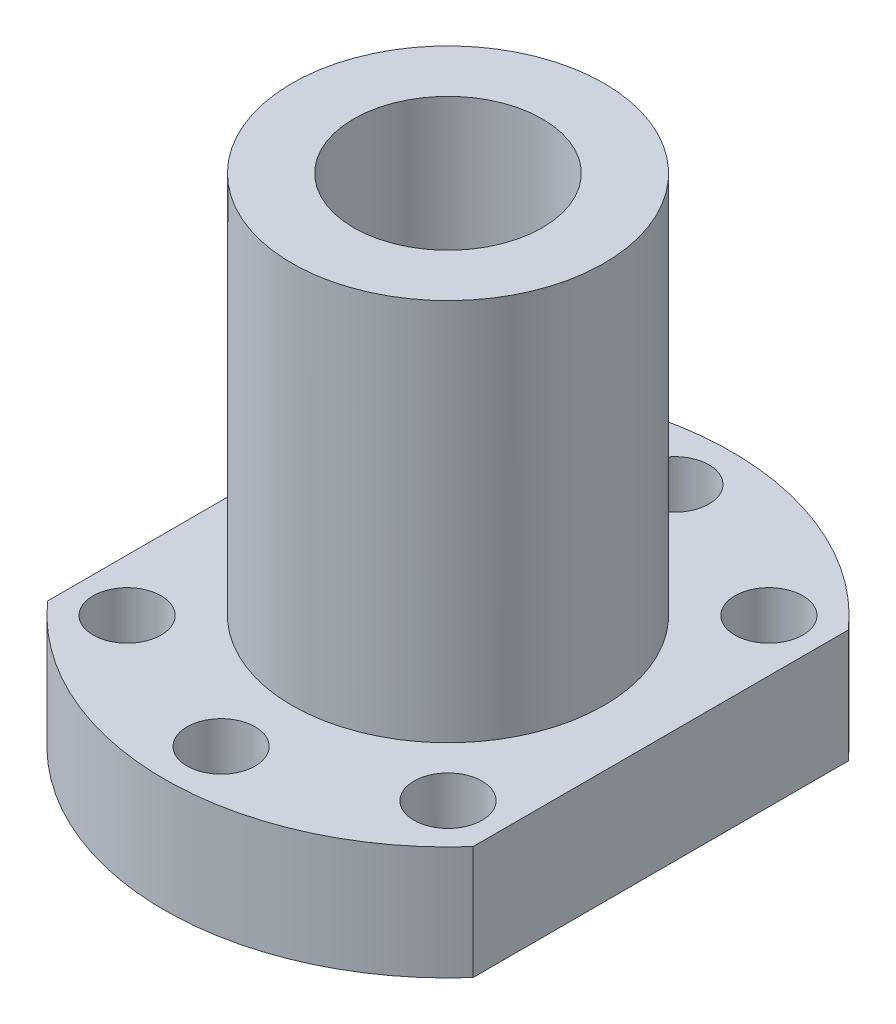
from build123d import *

# Parameters (mm, degrees)
SKETCH_1_R          = 20
EXTRUDE_1_DEPTH     = 8
SKETCH_3_R          = 11
EXTRUDE_2_DEPTH     = 35
CUT_EXTRUDE_1_DEPTH = 46
SKETCH_6_R          = 2.4
CUT_EXTRUDE_2_DEPTH = 44.011626335
SKETCH_7_R          = 6.65
CUT_EXTRUDE_3_DEPTH = 44.011626335


with BuildPart() as part:
    # 草图1 → 凸台-拉伸1 (new body)
    with BuildSketch(Plane(origin=(0, 0, 0), x_dir=(1, 0, 0), z_dir=(0, 1, 0))):
        Circle(SKETCH_1_R)
    extrude(amount=EXTRUDE_1_DEPTH)

    # 草图3 → 凸台-拉伸2 (add)
    with BuildSketch(Plane.XZ):
        Circle(SKETCH_3_R)
    extrude(amount=-EXTRUDE_2_DEPTH)

    # 草图4 → 切除-拉伸1 (cut, through all)
    with BuildSketch(Plane.XZ):
        with BuildLine():
            Line((-15, 13.228756555), (-15, -13.228756555))
            ThreePointArc((-15, -13.228756555), (-20, 0), (-15, 13.228756555))
        make_face()
        with BuildLine():
            Line((15, 13.228756555), (15, -13.228756555))
            ThreePointArc((15, -13.228756555), (20, 0), (15, 13.228756555))
        make_face()
    extrude(amount=-CUT_EXTRUDE_1_DEPTH, mode=Mode.SUBTRACT)

    # 草图6 → 切除-拉伸2 (cut, through all)
    with BuildSketch(Plane.XZ):
        with Locations((0, 16)):
            Circle(SKETCH_6_R)
        with Locations((11.313708499, 11.313708499)):
            Circle(SKETCH_6_R)
        with Locations((11.313708499, -11.313708499)):
            Circle(SKETCH_6_R)
        with Locations((0, -16)):
            Circle(SKETCH_6_R)
        with Locations((-11.313708499, -11.313708499)):
            Circle(SKETCH_6_R)
        with Locations((-11.313708499, 11.313708499)):
            Circle(SKETCH_6_R)
    extrude(amount=-CUT_EXTRUDE_2_DEPTH, mode=Mode.SUBTRACT)

    # 草图7 → 切除-拉伸3 (cut, through all)
    with BuildSketch(Plane.XZ):
        Circle(SKETCH_7_R)
    extrude(amount=-CUT_EXTRUDE_3_DEPTH, mode=Mode.SUBTRACT)


solid = part.part
